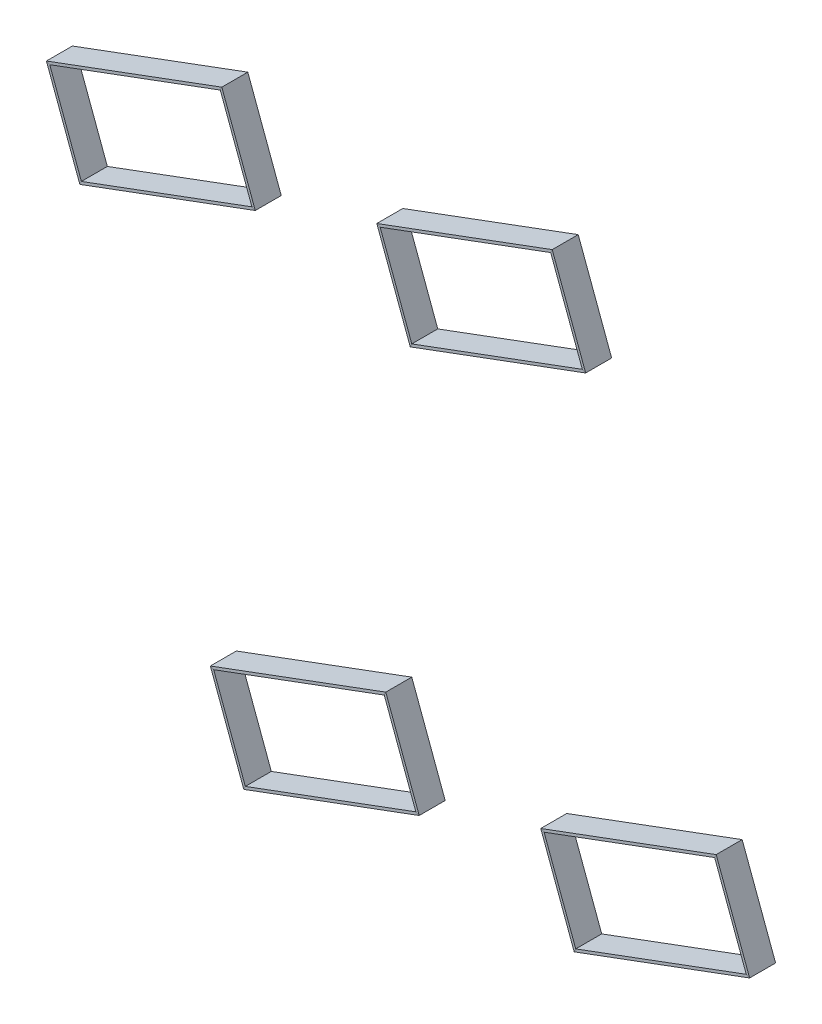
from build123d import *

# Parameters (mm, degrees)
SKETCH1_W       = 200
SKETCH1_H       = 2000
SWEEP6_START    = 17350
SWEEP6_DEPTH    = 2000
LPATTERN1_COUNT = 2
LPATTERN1_PITCH = 36280


# Read off the part's stored shape, not the designer's step: Sweep6
with BuildPart() as part:
    # Sweep1: sweep along a curve in space
    with BuildLine() as sweep1_path:
        Line((43984.852479613, 32514.773197836, 6350), (41550.204718904, 39077.736726706, 6350))
        Line((41550.204718904, 39077.736726706, 6350), (28424.277661165, 34208.441205286, 6350))
        Line((28424.277661165, 34208.441205286, 6350), (30858.925421874, 27645.477676417, 6350))
        Line((43984.852479613, 32514.773197836, 6350), (30858.925421874, 27645.477676417, 6350))
    # Sketch1 → Sweep1 (sweep)
    with BuildSketch(Plane(origin=(-5281.975673085, 14238.369205706, 0), x_dir=(0.93756621840993, 0.34780682295852583, 0), z_dir=(0.34780682295852583, -0.93756621840993, 0))):
        with Locations((38447.571771786, 6350)):
            Rectangle(SKETCH1_W, SKETCH1_H)
    sweep(path=sweep1_path.line, transition=Transition.RIGHT)


with BuildPart() as body_2:
    # Sweep6 outline → Sweep6 (new body)
    with BuildSketch(Plane.XY.offset(SWEEP6_START)):
        Polygon((81671.120440358, 46281.844659179), (79097.349950465, 53219.834675412), (65596.396405362, 48211.41642481), (68170.166895255, 41273.426408576), align=None)
        Polygon((78979.398071375, 52962.760067139), (81414.045832085, 46399.796538269), (68288.118774346, 41530.50101685), (65853.471013636, 48093.464545719), align=None, mode=Mode.SUBTRACT)
    extrude(amount=SWEEP6_DEPTH)


with BuildPart() as lpattern1_1:
    # LPattern1: pattern copy
    add(body_2.part.moved(Location(Vector(-0.34780682295852905, 0.9375662184099289, 0) * (1 * LPATTERN1_PITCH))))


with BuildPart() as lpattern1_2:
    # LPattern1: pattern copy
    add(part.part.moved(Location(Vector(-0.34780682295852905, 0.9375662184099289, 0) * (1 * LPATTERN1_PITCH))))


solid = Compound([part.part, body_2.part, lpattern1_1.part, lpattern1_2.part])
